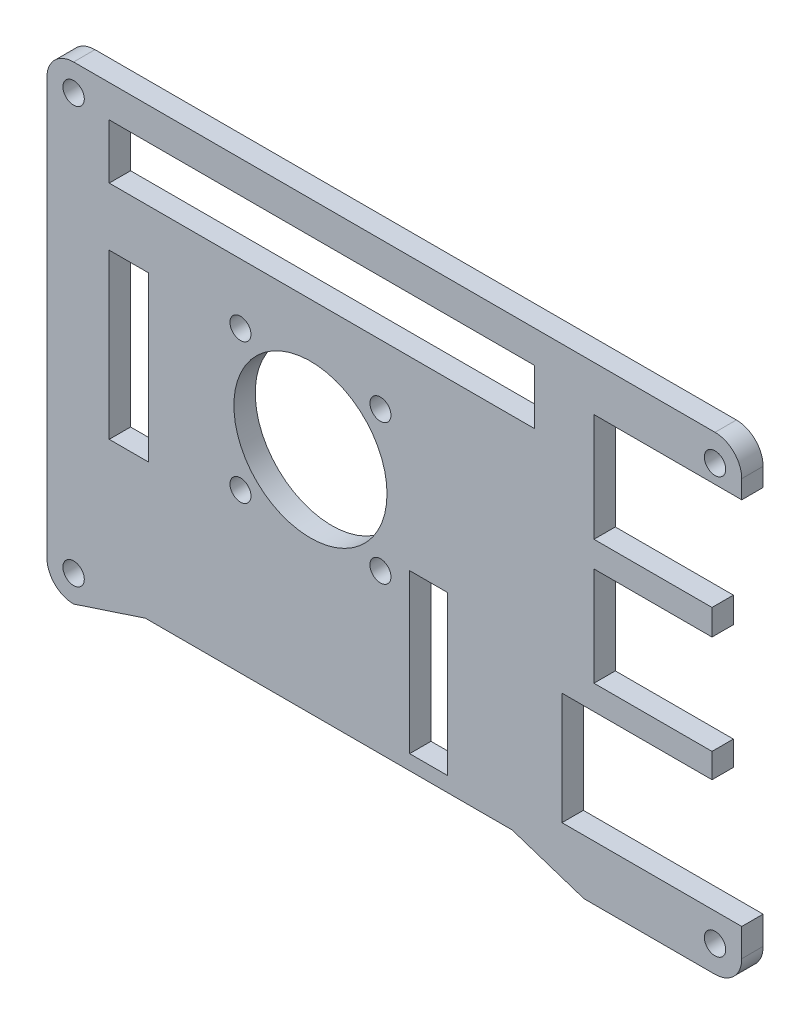
from build123d import *

# Parameters (mm, degrees)
SKETCH1_R           = 1.524
SKETCH1_W           = 5.4034
SKETCH1_H           = 22.6066
SKETCH1_W_2         = 60.6932
SKETCH1_H_2         = 7.81
BOSS_EXTRUDE1_DEPTH = 3.048
SKETCH2_R           = 10.922
SKETCH2_R_2         = 1.4986
CUT_EXTRUDE1_DEPTH  = 72.310891511


with BuildPart() as part:
    # Sketch1 → Boss-Extrude1 (new body)
    with BuildSketch(Plane.XY):
        with BuildLine():
            Line((40.134807375, 24.068294304), (61.214907375, 24.068294304))
            Line((61.214907375, 24.068294304), (61.214907375, 26.683892153))
            ThreePointArc((61.214907375, 26.683892153), (60.103884597, 29.386886916), (57.404932375, 30.507694304))
            Line((57.404932375, 30.507694304), (-34.084892625, 30.507694304))
            ThreePointArc((-34.084892625, 30.507694304), (-36.778969461, 29.391771141), (-37.894892625, 26.697694304))
            Line((-37.894892625, 26.697694304), (-37.894892625, -32.641005696))
            ThreePointArc((-37.894892625, -32.641005696), (-36.778969461, -35.335082532), (-34.084892625, -36.451005696))
            Line((-34.084892625, -36.451005696), (-23.844892625, -33.084405696))
            Line((-23.844892625, -33.084405696), (28.474307375, -33.084405696))
            Line((28.474307375, -33.084405696), (38.714307375, -36.451005696))
            Line((38.714307375, -36.451005696), (57.405007375, -36.451005696))
            ThreePointArc((57.405007375, -36.451005696), (60.108826144, -35.325305244), (61.214907375, -32.613401529))
            Line((61.214907375, -32.613401529), (61.214907375, -28.627805696))
            Line((61.214907375, -28.627805696), (35.575007375, -28.627805696))
            Line((35.575007375, -28.627805696), (35.575007375, -12.628005696))
            Line((35.575007375, -12.628005696), (56.975007375, -12.628005696))
            Line((56.975007375, -12.628005696), (56.975007375, -9.121805696))
            Line((56.975007375, -9.121805696), (40.134807375, -9.121805696))
            Line((40.134807375, -9.121805696), (40.134807375, 4.997894304))
            Line((40.134807375, 4.997894304), (56.975007375, 4.997894304))
            Line((56.975007375, 4.997894304), (56.975007375, 8.658194304))
            Line((56.975007375, 8.658194304), (40.134807375, 8.658194304))
            Line((40.134807375, 8.658194304), (40.134807375, 24.068294304))
        make_face()
        with Locations((-34.084892625, -32.641005696)):
            Circle(SKETCH1_R, mode=Mode.SUBTRACT)
        with Locations((57.405007375, -32.641005696)):
            Circle(SKETCH1_R, mode=Mode.SUBTRACT)
        with Locations((16.546707375, -19.663505696)):
            Rectangle(SKETCH1_W, SKETCH1_H, mode=Mode.SUBTRACT)
        Polygon((-29.004892625, 9.293194304), (-29.004892625, 9.801194304), (-23.416892625, 9.801194304), (-23.416892625, 9.293194304), (-23.416892625, -13.566805696), (-29.004892625, -13.566805696), align=None, mode=Mode.SUBTRACT)
        with Locations((-34.084892625, 26.697694304)):
            Circle(SKETCH1_R, mode=Mode.SUBTRACT)
        with Locations((1.341707375, 21.991994304)):
            Rectangle(SKETCH1_W_2, SKETCH1_H_2, mode=Mode.SUBTRACT)
        with Locations((57.404932375, 26.697694304)):
            Circle(SKETCH1_R, mode=Mode.SUBTRACT)
    extrude(amount=BOSS_EXTRUDE1_DEPTH)

    # Sketch2 → Cut-Extrude1 (cut, through all)
    with BuildSketch(Plane.XY.offset(3.048)):
        with Locations((-0.302892625, -0.480305696)):
            Circle(SKETCH2_R)
        with Locations((-10.285092625, -10.462505696)):
            Circle(SKETCH2_R_2)
        with Locations((-10.285092625, 9.501894304)):
            Circle(SKETCH2_R_2)
        with Locations((9.679307375, -10.462505696)):
            Circle(SKETCH2_R_2)
        with Locations((9.679307375, 9.501894304)):
            Circle(SKETCH2_R_2)
    extrude(amount=-CUT_EXTRUDE1_DEPTH, mode=Mode.SUBTRACT)


solid = part.part
